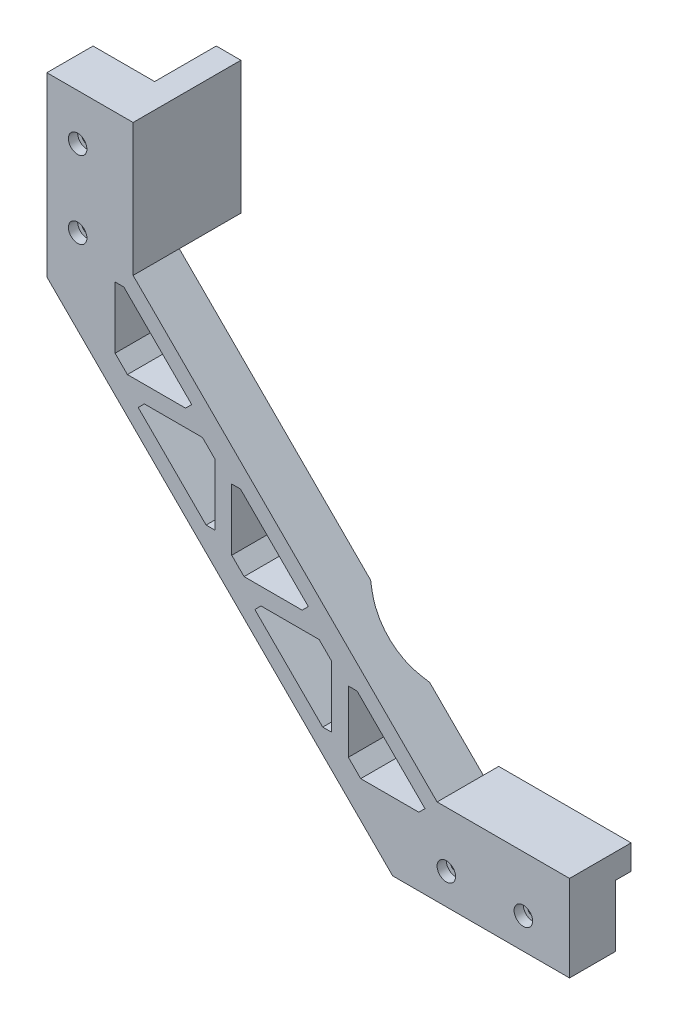
from build123d import *

# Parameters (mm, degrees)
EXTRUDE_1_DEPTH     = 15
SKETCH_3_W          = 43
SKETCH_3_H          = 8
EXTRUDE_2_DEPTH     = 35
SKETCH_4_W          = 8
SKETCH_4_H          = 43
EXTRUDE_3_DEPTH     = 35
CUT_EXTRUDE_1_DEPTH = 244.161454645
SKETCH_6_R          = 1.6
CUT_EXTRUDE_2_DEPTH = 244.161454645
SKETCH_7_R          = 3
CUT_EXTRUDE_3_DEPTH = 3
CHAMFER_1_SIZE      = 2.828427125
CHAMFER_1_SIZE_2    = 4
CUT_EXTRUDE_4_DEPTH = 133
SKETCH_9_W          = 15
SKETCH_9_H          = 8
CUT_EXTRUDE_5_DEPTH = 43


with BuildPart() as part:
    # 草图1 → 凸台-拉伸1 (new body)
    with BuildSketch(Plane.XY):
        Polygon((124.695, -160), (159.695, -160), (159.695, -180), (102.268593129, -180), (-10, -67.731406871), (-10, -10.305), (10, -10.305), (10, -45.305), align=None)
    extrude(amount=EXTRUDE_1_DEPTH)

    # 草图3 → 凸台-拉伸2 (add)
    with BuildSketch(Plane.XY.offset(15)):
        with Locations((138.195, -156)):
            Rectangle(SKETCH_3_W, SKETCH_3_H)
    extrude(amount=-EXTRUDE_2_DEPTH)

    # 草图4 → 凸台-拉伸3 (add)
    with BuildSketch(Plane.XY.offset(15)):
        with Locations((14, -31.805)):
            Rectangle(SKETCH_4_W, SKETCH_4_H)
    extrude(amount=-EXTRUDE_3_DEPTH)

    # 草图5 → 切除-拉伸1 (cut, through all)
    with BuildSketch(Plane.XY.offset(15)):
        Polygon((50.023383861, -93.106558454), (50.023383861, -119.976616139), (76.893441546, -119.976616139), align=None)
        Polygon((55.523383861, -125.476616139), (82.393441546, -125.476616139), (82.393441546, -152.346673824), align=None)
        Polygon((12.153326176, -55.236500769), (12.153326176, -82.106558454), (39.023383861, -82.106558454), align=None)
        Polygon((87.893441546, -130.976616139), (87.893441546, -157.846673824), (114.763499231, -157.846673824), align=None)
        Polygon((17.653326176, -87.606558454), (44.523383861, -87.606558454), (44.523383861, -114.476616139), align=None)
    extrude(amount=-CUT_EXTRUDE_1_DEPTH, mode=Mode.SUBTRACT)

    # 草图6 → 切除-拉伸2 (cut, through all)
    with BuildSketch(Plane.XY.offset(15)):
        with Locations((0, -50.305)):
            Circle(SKETCH_6_R)
        with Locations((0, -25.305)):
            Circle(SKETCH_6_R)
        with Locations((119.695, -170)):
            Circle(SKETCH_6_R)
        with Locations((144.695, -170)):
            Circle(SKETCH_6_R)
    extrude(amount=-CUT_EXTRUDE_2_DEPTH, mode=Mode.SUBTRACT)

    # 草图7 → 切除-拉伸3 (cut)
    with BuildSketch(Plane.XY.offset(15)):
        with Locations((0, -25.305)):
            Circle(SKETCH_7_R)
        with Locations((0, -50.305)):
            Circle(SKETCH_7_R)
        with Locations((119.695, -170)):
            Circle(SKETCH_7_R)
        with Locations((144.695, -170)):
            Circle(SKETCH_7_R)
    extrude(amount=-CUT_EXTRUDE_3_DEPTH, mode=Mode.SUBTRACT)

    # 倒角1
    # the kernel refuses this chamfer: 4, 2.828427125 mm, written as the material it adds along each edge
    with BuildSketch(Plane(origin=(82.393441546, -152.346673824, 15), x_dir=(0.05647824947248942, 0.9984038297885898, 0), z_dir=(0, 0, -1)), Plane(origin=(55.523383861, -125.476616139, 15), x_dir=(0.6660419652145875, -0.7459142715976752, 0), z_dir=(0, 0, -1)), Plane(origin=(87.893441546, -130.976616139, 15), x_dir=(-0.05647824947248942, -0.9984038297885898, 0), z_dir=(0, 0, -1)), Plane(origin=(12.153326176, -55.236500769, 15), x_dir=(-0.05647824947249038, -0.9984038297885897, 0), z_dir=(0, 0, -1)), Plane(origin=(44.523383861, -114.476616139, 15), x_dir=(0.05647824947248914, 0.9984038297885898, 0), z_dir=(0, 0, -1)), Plane(origin=(17.653326176, -87.606558454, 15), x_dir=(0.6660419652145882, -0.7459142715976745, 0), z_dir=(0, 0, -1)), Plane(origin=(50.023383861, -93.106558454, 15), x_dir=(-0.05647824947248914, -0.9984038297885898, 0), z_dir=(0, 0, -1))) as chamfer_1_piece_1:
        Polygon((CHAMFER_1_SIZE * 0.998403829699, -CHAMFER_1_SIZE * 0.0564782494674), (CHAMFER_1_SIZE_2 * 0.666041965215, -CHAMFER_1_SIZE_2 * 0.745914271598), (0, 0), align=None)
    extrude(amount=15)
    with BuildSketch(Plane(origin=(82.393441546, -125.476616139, 15), x_dir=(0.02749587661058555, -0.9996219169112968, 0), z_dir=(0, 0, -1)), Plane(origin=(87.893441546, -157.846673824, 15), x_dir=(-0.02749587661058555, 0.9996219169112968, 0), z_dir=(0, 0, -1)), Plane(origin=(12.153326176, -82.106558454, 15), x_dir=(-0.02749587661058651, 0.9996219169112968, 0), z_dir=(0, 0, -1)), Plane(origin=(44.523383861, -87.606558454, 15), x_dir=(0.027495876610585647, -0.9996219169112968, 0), z_dir=(0, 0, -1)), Plane(origin=(50.023383861, -119.976616139, 15), x_dir=(-0.027495876610585647, 0.9996219169112968, 0), z_dir=(0, 0, -1))) as chamfer_1_piece_2:
        Polygon((CHAMFER_1_SIZE_2 * 0.999621916911, CHAMFER_1_SIZE_2 * 0.0274958766106), (-CHAMFER_1_SIZE_2 * 0.0274958766106, CHAMFER_1_SIZE_2 * 0.999621916911), (0, 0), align=None)
    extrude(amount=15)
    with BuildSketch(Plane(origin=(114.763499231, -157.846673824, 15), x_dir=(-0.9996219169112968, -0.0274958766105891, 0), z_dir=(0, 0, -1)), Plane(origin=(39.023383861, -82.106558454, 15), x_dir=(-0.9996219169112968, -0.027495876610585647, 0), z_dir=(0, 0, -1)), Plane(origin=(76.893441546, -119.976616139, 15), x_dir=(-0.9996219169112968, -0.027495876610585647, 0), z_dir=(0, 0, -1))) as chamfer_1_piece_3:
        Polygon((CHAMFER_1_SIZE_2 * 0.999621916911, CHAMFER_1_SIZE_2 * 0.0274958766106), (CHAMFER_1_SIZE * 0.687396915203, CHAMFER_1_SIZE * 0.726281956812), (0, 0), align=None)
    extrude(amount=15)

    # 草图8 → 切除-拉伸4 (cut)
    with BuildSketch(Plane(origin=(159.695, 0, 0), x_dir=(0, 0, -1), z_dir=(1, 0, 0))):
        with BuildLine():
            Line((-1.18512051, -132.91098195), (0, -134.586598797))
            Line((0, -134.586598797), (0, -115.413471515))
            Line((0, -115.413471515), (-1.18512051, -117.089088362))
            ThreePointArc((-1.18512051, -117.089088362), (-3.7, -125.000035156), (-1.18512051, -132.91098195))
        make_face()
    extrude(amount=-CUT_EXTRUDE_4_DEPTH, mode=Mode.SUBTRACT)

    # 草图9 → 切除-拉伸5 (cut)
    with BuildSketch(Plane(origin=(159.695, 0, 0), x_dir=(0, 0, -1), z_dir=(1, 0, 0))):
        with Locations((12.5, -156)):
            Rectangle(SKETCH_9_W, SKETCH_9_H)
    extrude(amount=-CUT_EXTRUDE_5_DEPTH, mode=Mode.SUBTRACT)


solid = part.part
